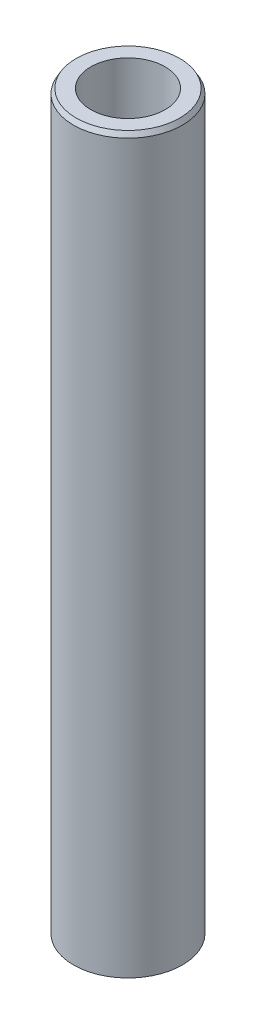
from build123d import *
from OCP.BRepFilletAPI import BRepFilletAPI_MakeChamfer

# Parameters (mm, degrees)
SKETCH1_R           = 20
BOSS_EXTRUDE1_DEPTH = 269.787280973
SKETCH2_R           = 13.65366113
CUT_EXTRUDE1_DEPTH  = 272.265878752
CHAMFER1_SIZE       = 1.743317147
CHAMFER1_SIZE2      = 1.006504624


with BuildPart() as part:
    # Sketch1 → Boss-Extrude1 (new body)
    with BuildSketch(Plane(origin=(0, 0, 0), x_dir=(1, 0, 0), z_dir=(0, 1, 0))):
        Circle(SKETCH1_R)
    extrude(amount=BOSS_EXTRUDE1_DEPTH)

    # Sketch2 → Cut-Extrude1 (cut, through all)
    with BuildSketch(Plane(origin=(0, 0, 0), x_dir=(1, 0, 0), z_dir=(0, 1, 0))):
        Circle(SKETCH2_R)
    extrude(amount=CUT_EXTRUDE1_DEPTH, mode=Mode.SUBTRACT)

    # Chamfer1: one chamfer whose edges measure the first distance from different faces: ONE call of the kernel's chamfer builder (chamfer() names one face for all edges)
    chamfer1_edges_1 = [part.edges().sort_by_distance(p)[0] for p in [
        (-20, 269.787280973, 0),
    ]]
    chamfer1_side_1 = [part.faces().sort_by_distance(p)[0] for p in [
        (-20, 134.893640487, 0),
    ]]
    chamfer1_edges_2 = [part.edges().sort_by_distance(p)[0] for p in [
        (-20, 0, 0),
    ]]
    chamfer1_side_2 = [part.faces().sort_by_distance(p)[0] for p in [
        (-19.434314575, 0, 0),
    ]]
    chamfer1 = BRepFilletAPI_MakeChamfer(part.part.solid().wrapped)
    for e in chamfer1_edges_1:
        chamfer1.Add(CHAMFER1_SIZE, CHAMFER1_SIZE2, e.wrapped, chamfer1_side_1[0].wrapped)  # the first distance lies on this face
    for e in chamfer1_edges_2:
        chamfer1.Add(CHAMFER1_SIZE, CHAMFER1_SIZE2, e.wrapped, chamfer1_side_2[0].wrapped)  # the first distance lies on this face
    add(Compound.cast(chamfer1.Shape()), mode=Mode.REPLACE)


solid = part.part
